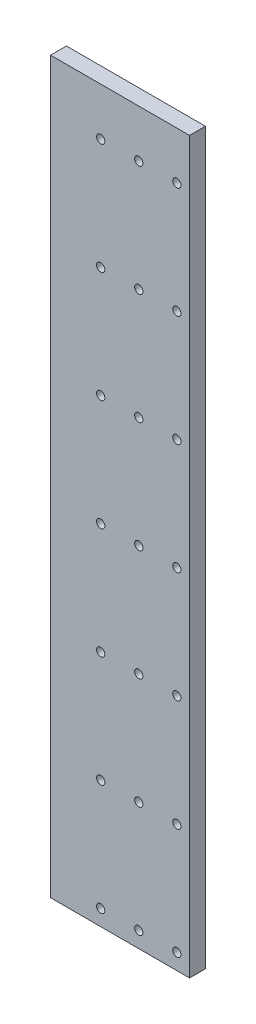
from build123d import *

# Parameters (mm, degrees)
MAIN_W                                    = 43.8
MAIN_H                                    = 230
MAIN_EXTRUSION_DEPTH                      = 2.5
MAIN_FIX_SKETCH_W                         = 8
MAIN_FIX_SKETCH_H                         = 230
MAIN_FIX_EXTRUSION_DEPTH                  = 2.5
MAIN_FIX_HOLE_SKETCH_R                    = 1.3
MAIN_FIX_HOLE_DEPTH                       = 250.664571611
MAIN_FIX_HOLE_HORIZONTAL_REPEAT_COUNT     = 3
MAIN_FIX_HOLE_HORIZONTAL_REPEAT_PITCH     = 12
FIX_HOLE_VERTICAL_REPEAT_COUNT            = 7
FIX_HOLE_VERTICAL_REPEAT_PITCH            = 35
FIX_HOLE_VERTICAL_REPEAT_COPY_1_SKETCH_R  = 1.3
FIX_HOLE_VERTICAL_REPEAT_COPY_1_DEPTH     = 250.664571611
FIX_HOLE_VERTICAL_REPEAT_COPY_2_SKETCH_R  = 1.3
FIX_HOLE_VERTICAL_REPEAT_COPY_2_DEPTH     = 250.664571611
FIX_HOLE_VERTICAL_REPEAT_COPY_3_SKETCH_R  = 1.3
FIX_HOLE_VERTICAL_REPEAT_COPY_3_DEPTH     = 250.664571611
FIX_HOLE_VERTICAL_REPEAT_COPY_4_SKETCH_R  = 1.3
FIX_HOLE_VERTICAL_REPEAT_COPY_4_DEPTH     = 250.664571611
FIX_HOLE_VERTICAL_REPEAT_COPY_5_SKETCH_R  = 1.3
FIX_HOLE_VERTICAL_REPEAT_COPY_5_DEPTH     = 250.664571611
FIX_HOLE_VERTICAL_REPEAT_COPY_6_SKETCH_R  = 1.3
FIX_HOLE_VERTICAL_REPEAT_COPY_6_DEPTH     = 250.664571611
FIX_HOLE_VERTICAL_REPEAT_COPY_7_SKETCH_R  = 1.3
FIX_HOLE_VERTICAL_REPEAT_COPY_7_DEPTH     = 250.664571611
FIX_HOLE_VERTICAL_REPEAT_COPY_8_SKETCH_R  = 1.3
FIX_HOLE_VERTICAL_REPEAT_COPY_8_DEPTH     = 250.664571611
FIX_HOLE_VERTICAL_REPEAT_COPY_9_SKETCH_R  = 1.3
FIX_HOLE_VERTICAL_REPEAT_COPY_9_DEPTH     = 250.664571611
FIX_HOLE_VERTICAL_REPEAT_COPY_10_SKETCH_R = 1.3
FIX_HOLE_VERTICAL_REPEAT_COPY_10_DEPTH    = 250.664571611
FIX_HOLE_VERTICAL_REPEAT_COPY_11_SKETCH_R = 1.3
FIX_HOLE_VERTICAL_REPEAT_COPY_11_DEPTH    = 250.664571611
FIX_HOLE_VERTICAL_REPEAT_COPY_12_SKETCH_R = 1.3
FIX_HOLE_VERTICAL_REPEAT_COPY_12_DEPTH    = 250.664571611
VERTICAL_RAINURE_W                        = 5
VERTICAL_RAINURE_H                        = 230
VERTICAL_RAINURE_EXTRUSION_DEPTH          = 2.5
HORIZONTAL_RAINURE_W                      = 30.8
HORIZONTAL_RAINURE_H                      = 6
HORIZONTAL_RAINURE_EXTRUSION_DEPTH        = 2.5
R_P_TITION_LIN_AIRE1_COUNT                = 8
R_P_TITION_LIN_AIRE1_PITCH                = 32
R_P_TITION_LIN_AIRE2_COUNT                = 2
R_P_TITION_LIN_AIRE2_PITCH                = 18
SLOT_SKETCH_EXTRUSION_DEPTH               = 20
CLIP_FIX_SKETCH_W                         = 2
CLIP_FIX_SKETCH_H                         = 4
SLOT_HOLE_SKETCH_R                        = 1.3
SLOT_HOLE_EXTRUSION_DEPTH                 = 246.570845175
SLOT_HOLE_HEAD_R                          = 3
SLOT_HOLE_HEAD_EXTRUSION_DEPTH            = 3
R_P_TITION_LIN_AIRE3_COUNT                = 3
R_P_TITION_LIN_AIRE3_PITCH                = 80


with BuildPart() as part:
    # Main → Main Extrusion (new body)
    with BuildSketch(Plane.XY):
        with Locations((46.710482565, 125)):
            Rectangle(MAIN_W, MAIN_H)
    extrude(amount=MAIN_EXTRUSION_DEPTH)

    # Main Fix Sketch → Main Fix - Extrusion (add)
    with BuildSketch(Plane(origin=(0, 0, 0), x_dir=(-1, 0, 0), z_dir=(0, 0, -1))):
        with Locations((-64.610482565, 125)):
            Rectangle(MAIN_FIX_SKETCH_W, MAIN_FIX_SKETCH_H)
    extrude(amount=MAIN_FIX_EXTRUSION_DEPTH)

    # Main Fix Hole Sketch → Main Fix Hole (cut, through all)
    with BuildSketch(Plane.XY.offset(2.5)):
        with Locations((64.610482565, 225)):
            Circle(MAIN_FIX_HOLE_SKETCH_R)
    main_fix_hole = extrude(amount=-MAIN_FIX_HOLE_DEPTH, mode=Mode.SUBTRACT)

    # Main Fix Hole Horizontal Repeat: Main Fix Hole ×3
    with Locations(*[(-i * MAIN_FIX_HOLE_HORIZONTAL_REPEAT_PITCH, 0, 0) for i in range(1, MAIN_FIX_HOLE_HORIZONTAL_REPEAT_COUNT)]):
        add(main_fix_hole, mode=Mode.SUBTRACT)

    # Fix Hole Vertical Repeat: Main Fix Hole ×7
    with Locations(*[(0, -i * FIX_HOLE_VERTICAL_REPEAT_PITCH, 0) for i in range(1, FIX_HOLE_VERTICAL_REPEAT_COUNT)]):
        add(main_fix_hole, mode=Mode.SUBTRACT)

    # Fix Hole Vertical Repeat copy 1 sketch → Fix Hole Vertical Repeat copy 1 (cut, through all)
    with BuildSketch(Plane(origin=(-12, -35, 2.5), x_dir=(1, 0, 0), z_dir=(0, 0, 1))):
        with Locations((64.610482565, 225)):
            Circle(FIX_HOLE_VERTICAL_REPEAT_COPY_1_SKETCH_R)
    extrude(amount=-FIX_HOLE_VERTICAL_REPEAT_COPY_1_DEPTH, mode=Mode.SUBTRACT)

    # Fix Hole Vertical Repeat copy 2 sketch → Fix Hole Vertical Repeat copy 2 (cut, through all)
    with BuildSketch(Plane(origin=(-12, -70, 2.5), x_dir=(1, 0, 0), z_dir=(0, 0, 1))):
        with Locations((64.610482565, 225)):
            Circle(FIX_HOLE_VERTICAL_REPEAT_COPY_2_SKETCH_R)
    extrude(amount=-FIX_HOLE_VERTICAL_REPEAT_COPY_2_DEPTH, mode=Mode.SUBTRACT)

    # Fix Hole Vertical Repeat copy 3 sketch → Fix Hole Vertical Repeat copy 3 (cut, through all)
    with BuildSketch(Plane(origin=(-12, -105, 2.5), x_dir=(1, 0, 0), z_dir=(0, 0, 1))):
        with Locations((64.610482565, 225)):
            Circle(FIX_HOLE_VERTICAL_REPEAT_COPY_3_SKETCH_R)
    extrude(amount=-FIX_HOLE_VERTICAL_REPEAT_COPY_3_DEPTH, mode=Mode.SUBTRACT)

    # Fix Hole Vertical Repeat copy 4 sketch → Fix Hole Vertical Repeat copy 4 (cut, through all)
    with BuildSketch(Plane(origin=(-12, -140, 2.5), x_dir=(1, 0, 0), z_dir=(0, 0, 1))):
        with Locations((64.610482565, 225)):
            Circle(FIX_HOLE_VERTICAL_REPEAT_COPY_4_SKETCH_R)
    extrude(amount=-FIX_HOLE_VERTICAL_REPEAT_COPY_4_DEPTH, mode=Mode.SUBTRACT)

    # Fix Hole Vertical Repeat copy 5 sketch → Fix Hole Vertical Repeat copy 5 (cut, through all)
    with BuildSketch(Plane(origin=(-12, -175, 2.5), x_dir=(1, 0, 0), z_dir=(0, 0, 1))):
        with Locations((64.610482565, 225)):
            Circle(FIX_HOLE_VERTICAL_REPEAT_COPY_5_SKETCH_R)
    extrude(amount=-FIX_HOLE_VERTICAL_REPEAT_COPY_5_DEPTH, mode=Mode.SUBTRACT)

    # Fix Hole Vertical Repeat copy 6 sketch → Fix Hole Vertical Repeat copy 6 (cut, through all)
    with BuildSketch(Plane(origin=(-12, -210, 2.5), x_dir=(1, 0, 0), z_dir=(0, 0, 1))):
        with Locations((64.610482565, 225)):
            Circle(FIX_HOLE_VERTICAL_REPEAT_COPY_6_SKETCH_R)
    extrude(amount=-FIX_HOLE_VERTICAL_REPEAT_COPY_6_DEPTH, mode=Mode.SUBTRACT)

    # Fix Hole Vertical Repeat copy 7 sketch → Fix Hole Vertical Repeat copy 7 (cut, through all)
    with BuildSketch(Plane(origin=(-24, -35, 2.5), x_dir=(1, 0, 0), z_dir=(0, 0, 1))):
        with Locations((64.610482565, 225)):
            Circle(FIX_HOLE_VERTICAL_REPEAT_COPY_7_SKETCH_R)
    extrude(amount=-FIX_HOLE_VERTICAL_REPEAT_COPY_7_DEPTH, mode=Mode.SUBTRACT)

    # Fix Hole Vertical Repeat copy 8 sketch → Fix Hole Vertical Repeat copy 8 (cut, through all)
    with BuildSketch(Plane(origin=(-24, -70, 2.5), x_dir=(1, 0, 0), z_dir=(0, 0, 1))):
        with Locations((64.610482565, 225)):
            Circle(FIX_HOLE_VERTICAL_REPEAT_COPY_8_SKETCH_R)
    extrude(amount=-FIX_HOLE_VERTICAL_REPEAT_COPY_8_DEPTH, mode=Mode.SUBTRACT)

    # Fix Hole Vertical Repeat copy 9 sketch → Fix Hole Vertical Repeat copy 9 (cut, through all)
    with BuildSketch(Plane(origin=(-24, -105, 2.5), x_dir=(1, 0, 0), z_dir=(0, 0, 1))):
        with Locations((64.610482565, 225)):
            Circle(FIX_HOLE_VERTICAL_REPEAT_COPY_9_SKETCH_R)
    extrude(amount=-FIX_HOLE_VERTICAL_REPEAT_COPY_9_DEPTH, mode=Mode.SUBTRACT)

    # Fix Hole Vertical Repeat copy 10 sketch → Fix Hole Vertical Repeat copy 10 (cut, through all)
    with BuildSketch(Plane(origin=(-24, -140, 2.5), x_dir=(1, 0, 0), z_dir=(0, 0, 1))):
        with Locations((64.610482565, 225)):
            Circle(FIX_HOLE_VERTICAL_REPEAT_COPY_10_SKETCH_R)
    extrude(amount=-FIX_HOLE_VERTICAL_REPEAT_COPY_10_DEPTH, mode=Mode.SUBTRACT)

    # Fix Hole Vertical Repeat copy 11 sketch → Fix Hole Vertical Repeat copy 11 (cut, through all)
    with BuildSketch(Plane(origin=(-24, -175, 2.5), x_dir=(1, 0, 0), z_dir=(0, 0, 1))):
        with Locations((64.610482565, 225)):
            Circle(FIX_HOLE_VERTICAL_REPEAT_COPY_11_SKETCH_R)
    extrude(amount=-FIX_HOLE_VERTICAL_REPEAT_COPY_11_DEPTH, mode=Mode.SUBTRACT)

    # Fix Hole Vertical Repeat copy 12 sketch → Fix Hole Vertical Repeat copy 12 (cut, through all)
    with BuildSketch(Plane(origin=(-24, -210, 2.5), x_dir=(1, 0, 0), z_dir=(0, 0, 1))):
        with Locations((64.610482565, 225)):
            Circle(FIX_HOLE_VERTICAL_REPEAT_COPY_12_SKETCH_R)
    extrude(amount=-FIX_HOLE_VERTICAL_REPEAT_COPY_12_DEPTH, mode=Mode.SUBTRACT)

    # Vertical Rainure → Vertical Rainure - Extrusion (add)
    with BuildSketch(Plane(origin=(0, 0, 0), x_dir=(-1, 0, 0), z_dir=(0, 0, -1))):
        with Locations((-27.310482565, 125)):
            Rectangle(VERTICAL_RAINURE_W, VERTICAL_RAINURE_H)
    vertical_rainure_extrusion = extrude(amount=VERTICAL_RAINURE_EXTRUSION_DEPTH)

    # Horizontal Rainure → Horizontal Rainure - Extrusion (add)
    with BuildSketch(Plane(origin=(0, 0, 0), x_dir=(-1, 0, 0), z_dir=(0, 0, -1))):
        with Locations((-45.210482565, 13)):
            Rectangle(HORIZONTAL_RAINURE_W, HORIZONTAL_RAINURE_H)
    horizontal_rainure_extrusion = extrude(amount=HORIZONTAL_RAINURE_EXTRUSION_DEPTH)

    # Répétition linéaire1: Horizontal Rainure - Extrusion ×8
    with Locations(*[(0, i * R_P_TITION_LIN_AIRE1_PITCH, 0) for i in range(1, R_P_TITION_LIN_AIRE1_COUNT)]):
        add(horizontal_rainure_extrusion)

    # Répétition linéaire2: Vertical Rainure - Extrusion ×2
    with Locations(*[(i * R_P_TITION_LIN_AIRE2_PITCH, 0, 0) for i in range(1, R_P_TITION_LIN_AIRE2_COUNT)]):
        add(vertical_rainure_extrusion)

    # Slot Sketch → Slot Sketch Extrusion (add)
    with BuildSketch(Plane(origin=(0, 176, 0), x_dir=(1, 0, 0), z_dir=(0, 1, 0))):
        Polygon((24.810482565, 15), (29.810482565, 15), (36.310482565, 0), (24.810482565, 0), (24.810482565, 5), (22.610482565, 5), (22.610482565, 2), (18.810482565, 5), (18.810482565, 10), (22.610482565, 13), (22.610482565, 10), (24.810482565, 10), align=None)
    slot_sketch_extrusion = extrude(amount=SLOT_SKETCH_EXTRUSION_DEPTH)

    # Clip Fix Sketch → Clip Fix Extrusion (revolve, cut)
    with BuildSketch(Plane(origin=(0, 0, -15), x_dir=(-1, 0, 0), z_dir=(0, 0, -1))):
        with Locations((-27.810482565, 180)):
            Rectangle(CLIP_FIX_SKETCH_W, CLIP_FIX_SKETCH_H)
        with Locations((-27.810482565, 192)):
            Rectangle(CLIP_FIX_SKETCH_W, CLIP_FIX_SKETCH_H)
    clip_fix_extrusion = revolve(axis=Axis((32.810482565, 252, -15), (0, -1, 0)), mode=Mode.SUBTRACT)

    # Slot Hole Sketch → Slot Hole Extrusion (cut, through all)
    with BuildSketch(Plane.ZY.offset(-18.810482565)):
        with Locations((-7.5, 186)):
            Circle(SLOT_HOLE_SKETCH_R)
    slot_hole_extrusion = extrude(amount=-SLOT_HOLE_EXTRUSION_DEPTH, mode=Mode.SUBTRACT)

    # Slot Hole Head → Slot Hole Head Extrusion (cut, symmetric)
    with BuildSketch(Plane.ZY.offset(-32.810482565)):
        with Locations((-7.5, 186)):
            Circle(SLOT_HOLE_HEAD_R)
    slot_hole_head_extrusion = extrude(amount=SLOT_HOLE_HEAD_EXTRUSION_DEPTH, both=True, mode=Mode.SUBTRACT)

    # Répétition linéaire3: Slot Sketch Extrusion, Clip Fix Extrusion, Slot Hole Extrusion, Slot Hole Head Extrusion ×3
    with Locations(*[(0, -i * R_P_TITION_LIN_AIRE3_PITCH, 0) for i in range(1, R_P_TITION_LIN_AIRE3_COUNT)]):
        add(slot_sketch_extrusion)
        add(clip_fix_extrusion, mode=Mode.SUBTRACT)
        add(slot_hole_extrusion, mode=Mode.SUBTRACT)
        add(slot_hole_head_extrusion, mode=Mode.SUBTRACT)


solid = part.part
